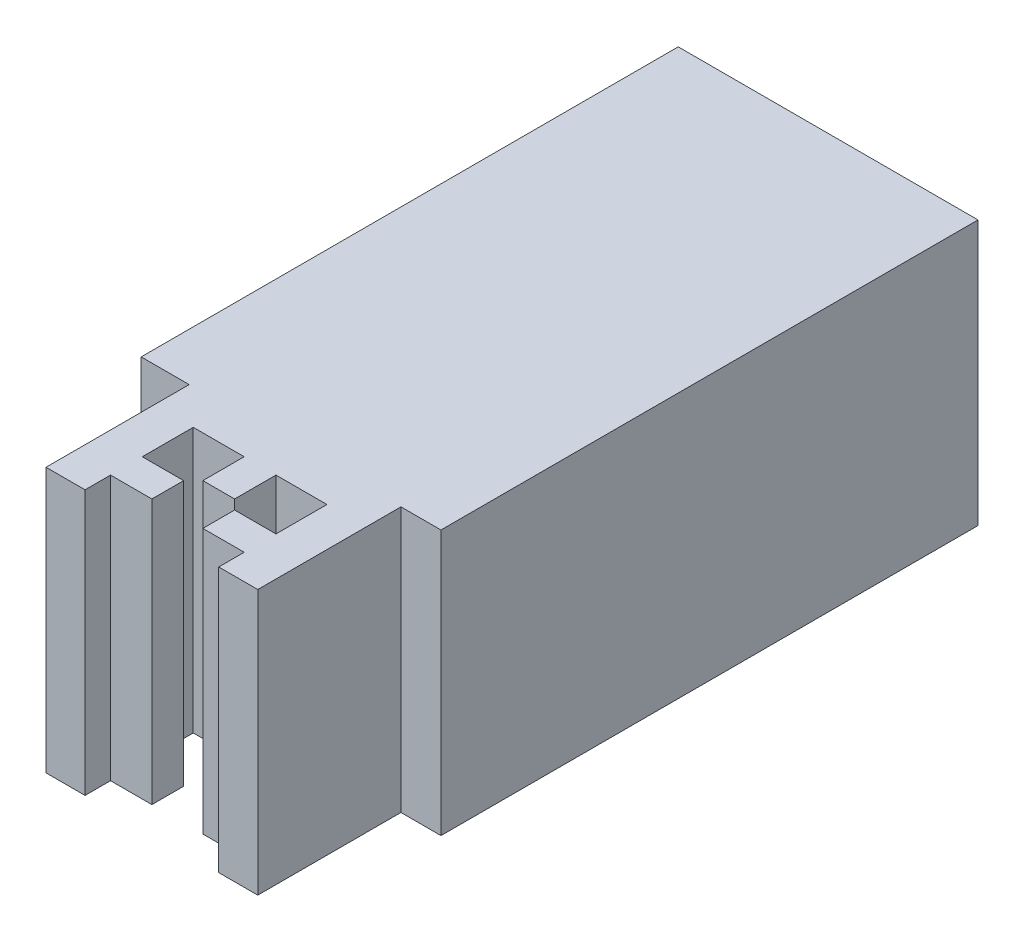
from build123d import *

# Parameters (mm, degrees)
BOSS_EXTRU_1_DEPTH                    = 20
ESQUISSE6_W                           = 20.2
ESQUISSE6_H                           = 20
ENL_V_MAT_EXTRU_1_DEPTH               = 3
ESQUISSE14_W                          = 30.8
ESQUISSE14_H                          = 2.5
BOSS_EXTRU_3_DEPTH                    = 40
CHANFREIN1_SIZE                       = 6.25
ESQUISSE16_W                          = 24.15
ESQUISSE16_H                          = 40
BOSS_EXTRU_4_DEPTH                    = 40
ESQUISSE18_W                          = 45.3
ESQUISSE18_H                          = 40
BOSS_EXTRU_5_DEPTH                    = 47
ESQUISSE17_R                          = 17.5
ENL_V_MAT_EXTRU_4_DEPTH               = 86
ESQUISSE19_W                          = 10
ESQUISSE19_H                          = 72.574491363
ENL_V_MAT_EXTRU_5_DEPTH               = 6
ESQUISSE22_R                          = 4
ENL_V_MAT_EXTRU_6_DEPTH               = 1
ESQUISSE23_R                          = 1.25
ENL_V_MAT_EXTRU_7_DEPTH               = 7
CHANFREIN4_SIZE                       = 0.25
ENL_VEMENT_DE_MATI_RE_BALAYAGE1_PITCH = 0.5
ESQUISSE56_W                          = 45.3
ESQUISSE56_H                          = 40
BOSS_EXTRU_6_DEPTH                    = 10
BOSS_EXTRU_8_DEPTH                    = 40
ESQUISSE61_W                          = 24.15
ESQUISSE61_H                          = 40
ENL_V_MAT_EXTRU_8_DEPTH               = 25.5
ESQUISSE63_R                          = 18
ENL_V_MAT_EXTRU_9_DEPTH               = 25


with BuildPart() as part:
    # Base → Boss.-Extru.1 (new, symmetric)
    with BuildSketch(Plane(origin=(0, 0, 0), x_dir=(1, 0, 0), z_dir=(0, 1, 0))):
        Polygon((-3.85, -2.4), (-3.85, 2.4), (-10.1, 2.4), (-10.1, 10.1), (-2.4, 10.1), (-2.4, 3.85), (2.4, 3.85), (2.4, 10.1), (10.1, 10.1), (10.1, 2.4), (3.85, 2.4), (3.85, -2.4), (10.1, -2.4), (10.1, -6.25), (15.4, -6.25), (15.4, 15.4), (-15.4, 15.4), (-15.4, -6.25), (-10.1, -6.25), (-10.1, -2.4), align=None)
    extrude(amount=BOSS_EXTRU_1_DEPTH, both=True)

    # Esquisse6 → Enlèv. mat.-Extru.1 (cut, symmetric)
    with BuildSketch(Plane.XY):
        Rectangle(ESQUISSE6_W, ESQUISSE6_H)
    extrude(amount=ENL_V_MAT_EXTRU_1_DEPTH, both=True, mode=Mode.SUBTRACT)

    # Esquisse14 → Boss.-Extru.3 (add)
    with BuildSketch(Plane.XZ.offset(20)):
        with Locations((0, -16.65)):
            Rectangle(ESQUISSE14_W, ESQUISSE14_H)
    extrude(amount=-BOSS_EXTRU_3_DEPTH)

    # Chanfrein1
    chanfrein1_edges = [part.edges().sort_by_distance(p)[0] for p in [
        (3.85, -10, 0),
        (-3.85, -10, 0),
    ]]
    chamfer(chanfrein1_edges, length=CHANFREIN1_SIZE - 0.0001)  # a hair under: the kernel refuses the full size

    # Esquisse16 → Boss.-Extru.4 (add)
    with BuildSketch(Plane(origin=(15.4, 0, 0), x_dir=(0, 0, -1), z_dir=(1, 0, 0))):
        with Locations((5.825, 0)):
            Rectangle(ESQUISSE16_W, ESQUISSE16_H)
    extrude(amount=BOSS_EXTRU_4_DEPTH)

    # Esquisse18 → Boss.-Extru.5 (add)
    with BuildSketch(Plane.XY.offset(6.25)):
        with Locations((32.75, 0)):
            Rectangle(ESQUISSE18_W, ESQUISSE18_H)
    extrude(amount=BOSS_EXTRU_5_DEPTH)

    # Esquisse17 → Enlèv. mat.-Extru.4 (cut)
    with BuildSketch(Plane(origin=(0, 0, -17.9), x_dir=(-1, 0, 0), z_dir=(0, 0, -1))):
        with Locations((-34.13383689, 0)):
            Circle(ESQUISSE17_R)
    extrude(amount=-ENL_V_MAT_EXTRU_4_DEPTH, mode=Mode.SUBTRACT)

    # Esquisse19 → Enlèv. mat.-Extru.5 (cut)
    with BuildSketch(Plane(origin=(0, -20, 0), x_dir=(-1, 0, 0), z_dir=(0, -1, 0))):
        with Locations((-34.1, -16.962754319)):
            Rectangle(ESQUISSE19_W, ESQUISSE19_H)
    extrude(amount=-ENL_V_MAT_EXTRU_5_DEPTH, mode=Mode.SUBTRACT)

    # Esquisse22 → Enlèv. mat.-Extru.6 (cut)
    with BuildSketch(Plane.ZY.offset(-10.1)):
        with Locations((39.697689273, 0)):
            Circle(ESQUISSE22_R)
    extrude(amount=-ENL_V_MAT_EXTRU_6_DEPTH, mode=Mode.SUBTRACT)

    # Esquisse23 → Enlèv. mat.-Extru.7 (cut)
    with BuildSketch(Plane.ZY.offset(-11.1)):
        with Locations((39.697689273, 0)):
            Circle(ESQUISSE23_R)
    extrude(amount=-ENL_V_MAT_EXTRU_7_DEPTH, mode=Mode.SUBTRACT)

    # Chanfrein4
    chanfrein4_edges = [part.edges().sort_by_distance(p)[0] for p in [
        (11.1, 0, 38.447689273),
    ]]
    chamfer(chanfrein4_edges, length=CHANFREIN4_SIZE)

    # Enlèvement de matière-Balayage1: arcs per turn and ends read off the stored shape
    # Enlèvement de matière-Balayage1: the profile of Esquisse55 screwed along a right-hand helix through 20 turns, 6 arcs to a turn; built about Z, then put on its axis
    enl_vement_de_mati_re_balayage1_z = Axis((0, 0, 0), (0, 0, 1))
    enl_vement_de_mati_re_balayage1_corners = [(1.24922135, 4.36e-07, -0.053702807), (1.24922135, 4.36e-07, -0.446297137), (1.49922135, 5.23e-07, -0.252782825)]
    with BuildLine(mode=Mode.PRIVATE) as enl_vement_de_mati_re_balayage1_profile:
        Line(enl_vement_de_mati_re_balayage1_corners[0], enl_vement_de_mati_re_balayage1_corners[1])
        Line(enl_vement_de_mati_re_balayage1_corners[1], enl_vement_de_mati_re_balayage1_corners[2])
        Line(enl_vement_de_mati_re_balayage1_corners[2], enl_vement_de_mati_re_balayage1_corners[0])
    enl_vement_de_mati_re_balayage1_cap = Face(enl_vement_de_mati_re_balayage1_profile.wire())
    enl_vement_de_mati_re_balayage1_turn_angles = [0, 30, 60, 90, 120, 150, 180, 210, 240, 270, 300, 330, 360]
    enl_vement_de_mati_re_balayage1_turn_weights = [1, 0.8660254037844387, 1, 0.8660254037844387, 1, 0.8660254037844387, 1, 0.8660254037844387, 1, 0.8660254037844387, 1, 0.8660254037844387, 1]
    enl_vement_de_mati_re_balayage1_turn_rails = [Edge.make_bspline([Vector(p[0], p[1], 0).rotate(enl_vement_de_mati_re_balayage1_z, enl_vement_de_mati_re_balayage1_turn_angles[k]) / enl_vement_de_mati_re_balayage1_turn_weights[k] + Vector(0, 0, p[2] + ENL_VEMENT_DE_MATI_RE_BALAYAGE1_PITCH * enl_vement_de_mati_re_balayage1_turn_angles[k] / 360) for k in range(13)], [0, 0, 0, 1, 1, 2, 2, 3, 3, 4, 4, 5, 5, 6, 6, 6], 2, enl_vement_de_mati_re_balayage1_turn_weights) for p in enl_vement_de_mati_re_balayage1_corners]
    enl_vement_de_mati_re_balayage1_turn_sides = [Face.make_surface_from_curves(enl_vement_de_mati_re_balayage1_turn_rails[p[0]], enl_vement_de_mati_re_balayage1_turn_rails[p[1]]) for p in [(0, 1), (1, 2), (2, 0)]]
    enl_vement_de_mati_re_balayage1 = Plane(origin=(10.1, 0, 39.697689273), x_dir=(0, 0.707106781186547, -0.707106781186548), z_dir=(1, 0, 0)) * Solid(Shell([*[p.moved(Location((0, 0, ENL_VEMENT_DE_MATI_RE_BALAYAGE1_PITCH * i))) for i in range(20) for p in enl_vement_de_mati_re_balayage1_turn_sides], enl_vement_de_mati_re_balayage1_cap, enl_vement_de_mati_re_balayage1_cap.rotate(enl_vement_de_mati_re_balayage1_z, 7200).moved(Location((0, 0, ENL_VEMENT_DE_MATI_RE_BALAYAGE1_PITCH * 7200 / 360)))]))
    add(enl_vement_de_mati_re_balayage1, mode=Mode.SUBTRACT)

    # Esquisse56 → Boss.-Extru.6 (add)
    with BuildSketch(Plane.XY.offset(53.25)):
        with Locations((32.75, 0)):
            Rectangle(ESQUISSE56_W, ESQUISSE56_H)
    extrude(amount=BOSS_EXTRU_6_DEPTH)

    # Esquisse60 → Boss.-Extru.8 (add)
    with BuildSketch(Plane(origin=(0, 20, 0), x_dir=(1, 0, 0), z_dir=(0, 1, 0))):
        Polygon((29.499987841, -81.03330305), (29.499987841, -76.23330305), (23.249987841, -76.23330305), (23.249987841, -68.53330305), (30.949987841, -68.53330305), (30.949987841, -74.78330305), (35.749987841, -74.78330305), (35.749987841, -68.53330305), (43.449987841, -68.53330305), (43.449987841, -76.23330305), (37.199987841, -76.23330305), (37.199987841, -81.03330305), (43.449987841, -81.03330305), (43.449987841, -84.88330305), (49.349975681, -84.88330305), (49.349975681, -62.633315209), (17.35, -62.633315209), (17.35, -84.88330305), (23.249987841, -84.88330305), (23.249987841, -81.03330305), align=None)
    extrude(amount=-BOSS_EXTRU_8_DEPTH)

    # Esquisse61 → Enlèv. mat.-Extru.8 (cut)
    with BuildSketch(Plane.ZY.offset(15.4)):
        with Locations((-5.825, 0)):
            Rectangle(ESQUISSE61_W, ESQUISSE61_H)
    extrude(amount=-ENL_V_MAT_EXTRU_8_DEPTH, mode=Mode.SUBTRACT)

    # Esquisse63 → Enlèv. mat.-Extru.9 (cut)
    with BuildSketch(Plane(origin=(0, 0, -17.9), x_dir=(-1, 0, 0), z_dir=(0, 0, -1))):
        with Locations((-34.13383689, 0)):
            Circle(ESQUISSE63_R)
    extrude(amount=-ENL_V_MAT_EXTRU_9_DEPTH, mode=Mode.SUBTRACT)


solid = part.part
